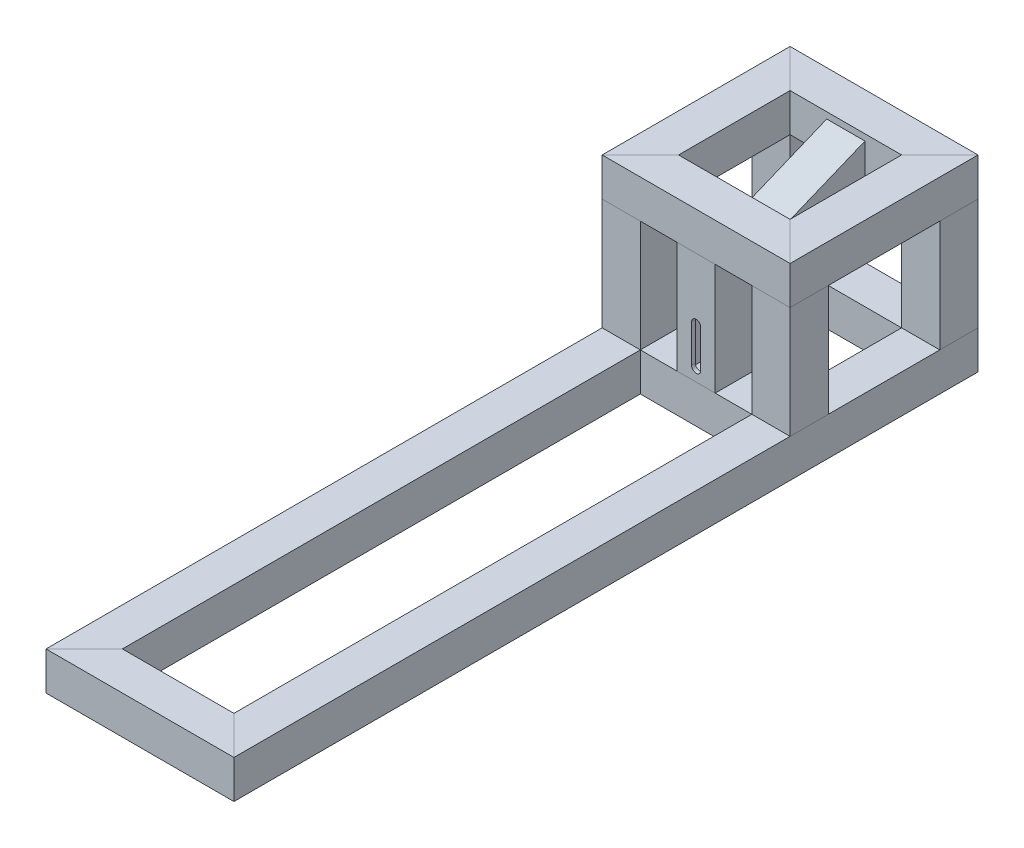
from build123d import *

# Parameters (mm, degrees)
PTR_START                             = 21.849800144
PTR_ASTM_A36_50X50X2_1_OUTLINE_W      = 50
PTR_ASTM_A36_50X50X2_1_OUTLINE_H      = 50
PTR_ASTM_A36_50X50X2_1_OUTLINE_W_2    = 40
PTR_ASTM_A36_50X50X2_1_OUTLINE_H_2    = 40
PTR_ASTM_A36_50X50X2_1_DEPTH          = 146
PTR_START_2                           = -28.150199856
PTR_ASTM_A36_50X50X2_1_2_DEPTH        = 50
PTR_ASTM_A36_50X50X2_1_3_DEPTH        = 5
PTR_START_3                           = 16.849800144
PTR_ASTM_A36_50X50X2_1_4_DEPTH        = 5
PTR_ASTM_A36_50X50X2_1_5_DEPTH        = 50
PTR_ASTM_A36_50X50X2_1_6_DEPTH        = 5
PTR_ASTM_A36_50X50X2_1_7_DEPTH        = 5
PTR_ASTM_A36_50X50X2_1_8_OUTLINE_W    = 50
PTR_ASTM_A36_50X50X2_1_8_OUTLINE_H    = 50
PTR_ASTM_A36_50X50X2_1_8_OUTLINE_W_2  = 40
PTR_ASTM_A36_50X50X2_1_8_OUTLINE_H_2  = 40
PTR_ASTM_A36_50X50X2_1_8_DEPTH        = 146
PTR_ASTM_A36_50X50X2_1_9_DEPTH        = 50
PTR_ASTM_A36_50X50X2_1_10_DEPTH       = 5
PTR_ASTM_A36_50X50X2_1_11_DEPTH       = 5
PTR_ASTM_A36_50X50X2_1_12_DEPTH       = 50
PTR_ASTM_A36_50X50X2_1_13_DEPTH       = 5
PTR_ASTM_A36_50X50X2_1_14_DEPTH       = 5
PTR_START_4                           = 167.849800144
PTR_ASTM_A36_50X50X2_1_15_DEPTH       = 50
PTR_ASTM_A36_50X50X2_1_16_DEPTH       = 5
PTR_START_5                           = 212.849800144
PTR_ASTM_A36_50X50X2_1_17_DEPTH       = 5
PTR_ASTM_A36_50X50X2_1_18_DEPTH       = 50
PTR_ASTM_A36_50X50X2_1_19_DEPTH       = 5
PTR_ASTM_A36_50X50X2_1_20_DEPTH       = 5
PTR_ASTM_A36_50X50X2_1_21_OUTLINE_W   = 50
PTR_ASTM_A36_50X50X2_1_21_OUTLINE_H   = 50
PTR_ASTM_A36_50X50X2_1_21_OUTLINE_W_2 = 40
PTR_ASTM_A36_50X50X2_1_21_OUTLINE_H_2 = 40
PTR_ASTM_A36_50X50X2_1_21_DEPTH       = 146
PTR_ASTM_A36_50X50X2_1_22_DEPTH       = 50
PTR_ASTM_A36_50X50X2_1_23_DEPTH       = 5
PTR_ASTM_A36_50X50X2_1_24_DEPTH       = 5
PTR_ASTM_A36_50X50X2_1_25_OUTLINE_W   = 50
PTR_ASTM_A36_50X50X2_1_25_OUTLINE_H   = 50
PTR_ASTM_A36_50X50X2_1_25_OUTLINE_W_2 = 40
PTR_ASTM_A36_50X50X2_1_25_OUTLINE_H_2 = 40
PTR_ASTM_A36_50X50X2_1_25_DEPTH       = 146
PTR_ASTM_A36_50X50X2_1_26_DEPTH       = 50
PTR_ASTM_A36_50X50X2_1_27_DEPTH       = 5
PTR_ASTM_A36_50X50X2_1_28_DEPTH       = 5
PTR_START_6                           = -133.458725993
PTR_ASTM_A36_50X50X2_1_29_OUTLINE_W   = 50
PTR_ASTM_A36_50X50X2_1_29_OUTLINE_H   = 50
PTR_ASTM_A36_50X50X2_1_29_OUTLINE_W_2 = 40
PTR_ASTM_A36_50X50X2_1_29_OUTLINE_H_2 = 40
PTR_ASTM_A36_50X50X2_1_29_DEPTH       = 146
PTR_ASTM_A36_50X50X2_1_30_OUTLINE_W   = 50
PTR_ASTM_A36_50X50X2_1_30_OUTLINE_H   = 50
PTR_ASTM_A36_50X50X2_1_30_OUTLINE_W_2 = 40
PTR_ASTM_A36_50X50X2_1_30_OUTLINE_H_2 = 40
PTR_ASTM_A36_50X50X2_1_30_DEPTH       = 146
PTR_START_7                           = -85.458725993
PTR_ASTM_A36_50X50X2_1_31_DEPTH       = 50
PTR_ASTM_A36_50X50X2_1_32_DEPTH       = 5
PTR_START_8                           = -40.458725993
PTR_ASTM_A36_50X50X2_1_33_DEPTH       = 5
CUT_EXTRUDE1_REACH                    = 783.729


# Read off the part's stored shape, not the designer's step: Ptr ASTM A36 50X50X2(1)
with BuildPart() as part:
    # Ptr ASTM A36 50X50X2(1) outline → Ptr ASTM A36 50X50X2(1) (new body)
    with BuildSketch(Plane(origin=(0, 0, 0), x_dir=(1, 0, 0), z_dir=(0, 1, 0)).offset(PTR_START)):
        with Locations((-158.458725993, 363.108258385)):
            Rectangle(PTR_ASTM_A36_50X50X2_1_OUTLINE_W, PTR_ASTM_A36_50X50X2_1_OUTLINE_H)
        with Locations((-158.458725993, 363.108258385)):
            Rectangle(PTR_ASTM_A36_50X50X2_1_OUTLINE_W_2, PTR_ASTM_A36_50X50X2_1_OUTLINE_H_2, mode=Mode.SUBTRACT)
    extrude(amount=PTR_ASTM_A36_50X50X2_1_DEPTH)


with BuildPart() as body_2:
    # Ptr ASTM A36 50X50X2_1 2 outline → Ptr ASTM A36 50X50X2_1 2 (new body)
    with BuildSketch(Plane(origin=(0, 0, 0), x_dir=(1, 0, 0), z_dir=(0, 1, 0)).offset(PTR_START_2)):
        Polygon((-133.458725993, 338.108258385), (12.541274007, 338.108258385), (17.541274007, 343.108258385), (-138.458725993, 343.108258385), align=None)
        Polygon((-178.458725993, 383.108258385), (57.541274007, 383.108258385), (62.541274007, 388.108258385), (-183.458725993, 388.108258385), align=None)
    extrude(amount=PTR_ASTM_A36_50X50X2_1_2_DEPTH)

    # Ptr ASTM A36 50X50X2_1 3 outline → Ptr ASTM A36 50X50X2_1 3 (add)
    with BuildSketch(Plane(origin=(0, 0, 0), x_dir=(1, 0, 0), z_dir=(0, 1, 0)).offset(PTR_START_2)):
        Polygon((-138.458725993, 343.108258385), (17.541274007, 343.108258385), (57.541274007, 383.108258385), (-178.458725993, 383.108258385), align=None)
    extrude(amount=PTR_ASTM_A36_50X50X2_1_3_DEPTH)

    # Ptr ASTM A36 50X50X2_1 4 outline → Ptr ASTM A36 50X50X2_1 4 (add)
    with BuildSketch(Plane(origin=(0, 0, 0), x_dir=(1, 0, 0), z_dir=(0, 1, 0)).offset(PTR_START_3)):
        Polygon((-138.458725993, 343.108258385), (17.541274007, 343.108258385), (57.541274007, 383.108258385), (-178.458725993, 383.108258385), align=None)
    extrude(amount=PTR_ASTM_A36_50X50X2_1_4_DEPTH)


with BuildPart() as body_3:
    # Ptr ASTM A36 50X50X2_1 5 outline → Ptr ASTM A36 50X50X2_1 5 (new body)
    with BuildSketch(Plane(origin=(0, 0, 0), x_dir=(1, 0, 0), z_dir=(0, 1, 0)).offset(PTR_START_2)):
        Polygon((-133.458725993, -535.891741615), (-133.458725993, 338.108258385), (-138.458725993, 343.108258385), (-138.458725993, -540.891741615), align=None)
        Polygon((-178.458725993, -580.891741615), (-178.458725993, 383.108258385), (-183.458725993, 388.108258385), (-183.458725993, -585.891741615), align=None)
    extrude(amount=PTR_ASTM_A36_50X50X2_1_5_DEPTH)

    # Ptr ASTM A36 50X50X2_1 6 outline → Ptr ASTM A36 50X50X2_1 6 (add)
    with BuildSketch(Plane(origin=(0, 0, 0), x_dir=(1, 0, 0), z_dir=(0, 1, 0)).offset(PTR_START_2)):
        Polygon((-138.458725993, -540.891741615), (-138.458725993, 343.108258385), (-178.458725993, 383.108258385), (-178.458725993, -580.891741615), align=None)
    extrude(amount=PTR_ASTM_A36_50X50X2_1_6_DEPTH)

    # Ptr ASTM A36 50X50X2_1 7 outline → Ptr ASTM A36 50X50X2_1 7 (add)
    with BuildSketch(Plane(origin=(0, 0, 0), x_dir=(1, 0, 0), z_dir=(0, 1, 0)).offset(PTR_START_3)):
        Polygon((-138.458725993, -540.891741615), (-138.458725993, 343.108258385), (-178.458725993, 383.108258385), (-178.458725993, -580.891741615), align=None)
    extrude(amount=PTR_ASTM_A36_50X50X2_1_7_DEPTH)


with BuildPart() as body_4:
    # Ptr ASTM A36 50X50X2_1 8 outline → Ptr ASTM A36 50X50X2_1 8 (new body)
    with BuildSketch(Plane(origin=(0, 0, 0), x_dir=(1, 0, 0), z_dir=(0, 1, 0)).offset(PTR_START)):
        with Locations((37.541274007, 363.108258385)):
            Rectangle(PTR_ASTM_A36_50X50X2_1_8_OUTLINE_W, PTR_ASTM_A36_50X50X2_1_8_OUTLINE_H)
        with Locations((37.541274007, 363.108258385)):
            Rectangle(PTR_ASTM_A36_50X50X2_1_8_OUTLINE_W_2, PTR_ASTM_A36_50X50X2_1_8_OUTLINE_H_2, mode=Mode.SUBTRACT)
    extrude(amount=PTR_ASTM_A36_50X50X2_1_8_DEPTH)


with BuildPart() as body_5:
    # Ptr ASTM A36 50X50X2_1 9 outline → Ptr ASTM A36 50X50X2_1 9 (new body)
    with BuildSketch(Plane(origin=(0, 0, 0), x_dir=(1, 0, 0), z_dir=(0, 1, 0)).offset(PTR_START_2)):
        Polygon((12.541274007, 338.108258385), (12.541274007, -535.891741615), (17.541274007, -540.891741615), (17.541274007, 343.108258385), align=None)
        Polygon((57.541274007, 383.108258385), (57.541274007, -580.891741615), (62.541274007, -585.891741615), (62.541274007, 388.108258385), align=None)
    extrude(amount=PTR_ASTM_A36_50X50X2_1_9_DEPTH)

    # Ptr ASTM A36 50X50X2_1 10 outline → Ptr ASTM A36 50X50X2_1 10 (add)
    with BuildSketch(Plane(origin=(0, 0, 0), x_dir=(1, 0, 0), z_dir=(0, 1, 0)).offset(PTR_START_2)):
        Polygon((17.541274007, 343.108258385), (17.541274007, -540.891741615), (57.541274007, -580.891741615), (57.541274007, 383.108258385), align=None)
    extrude(amount=PTR_ASTM_A36_50X50X2_1_10_DEPTH)

    # Ptr ASTM A36 50X50X2_1 11 outline → Ptr ASTM A36 50X50X2_1 11 (add)
    with BuildSketch(Plane(origin=(0, 0, 0), x_dir=(1, 0, 0), z_dir=(0, 1, 0)).offset(PTR_START_3)):
        Polygon((17.541274007, 343.108258385), (17.541274007, -540.891741615), (57.541274007, -580.891741615), (57.541274007, 383.108258385), align=None)
    extrude(amount=PTR_ASTM_A36_50X50X2_1_11_DEPTH)


with BuildPart() as body_6:
    # Ptr ASTM A36 50X50X2_1 12 outline → Ptr ASTM A36 50X50X2_1 12 (new body)
    with BuildSketch(Plane(origin=(0, 0, 0), x_dir=(1, 0, 0), z_dir=(0, 1, 0)).offset(PTR_START_2)):
        Polygon((12.541274007, -535.891741615), (-133.458725993, -535.891741615), (-138.458725993, -540.891741615), (17.541274007, -540.891741615), align=None)
        Polygon((57.541274007, -580.891741615), (-178.458725993, -580.891741615), (-183.458725993, -585.891741615), (62.541274007, -585.891741615), align=None)
    extrude(amount=PTR_ASTM_A36_50X50X2_1_12_DEPTH)

    # Ptr ASTM A36 50X50X2_1 13 outline → Ptr ASTM A36 50X50X2_1 13 (add)
    with BuildSketch(Plane(origin=(0, 0, 0), x_dir=(1, 0, 0), z_dir=(0, 1, 0)).offset(PTR_START_2)):
        Polygon((17.541274007, -540.891741615), (-138.458725993, -540.891741615), (-178.458725993, -580.891741615), (57.541274007, -580.891741615), align=None)
    extrude(amount=PTR_ASTM_A36_50X50X2_1_13_DEPTH)

    # Ptr ASTM A36 50X50X2_1 14 outline → Ptr ASTM A36 50X50X2_1 14 (add)
    with BuildSketch(Plane(origin=(0, 0, 0), x_dir=(1, 0, 0), z_dir=(0, 1, 0)).offset(PTR_START_3)):
        Polygon((17.541274007, -540.891741615), (-138.458725993, -540.891741615), (-178.458725993, -580.891741615), (57.541274007, -580.891741615), align=None)
    extrude(amount=PTR_ASTM_A36_50X50X2_1_14_DEPTH)


with BuildPart() as body_7:
    # Ptr ASTM A36 50X50X2_1 15 outline → Ptr ASTM A36 50X50X2_1 15 (new body)
    with BuildSketch(Plane(origin=(0, 0, 0), x_dir=(1, 0, 0), z_dir=(0, 1, 0)).offset(PTR_START_4)):
        Polygon((-183.458725993, 388.108258385), (-183.458725993, 142.108258385), (-178.458725993, 147.108258385), (-178.458725993, 383.108258385), align=None)
        Polygon((-138.458725993, 343.108258385), (-138.458725993, 187.108258385), (-133.458725993, 192.108258385), (-133.458725993, 338.108258385), align=None)
    extrude(amount=PTR_ASTM_A36_50X50X2_1_15_DEPTH)

    # Ptr ASTM A36 50X50X2_1 16 outline → Ptr ASTM A36 50X50X2_1 16 (add)
    with BuildSketch(Plane(origin=(0, 0, 0), x_dir=(1, 0, 0), z_dir=(0, 1, 0)).offset(PTR_START_4)):
        Polygon((-178.458725993, 383.108258385), (-178.458725993, 147.108258385), (-138.458725993, 187.108258385), (-138.458725993, 343.108258385), align=None)
    extrude(amount=PTR_ASTM_A36_50X50X2_1_16_DEPTH)

    # Ptr ASTM A36 50X50X2_1 17 outline → Ptr ASTM A36 50X50X2_1 17 (add)
    with BuildSketch(Plane(origin=(0, 0, 0), x_dir=(1, 0, 0), z_dir=(0, 1, 0)).offset(PTR_START_5)):
        Polygon((-178.458725993, 383.108258385), (-178.458725993, 147.108258385), (-138.458725993, 187.108258385), (-138.458725993, 343.108258385), align=None)
    extrude(amount=PTR_ASTM_A36_50X50X2_1_17_DEPTH)


with BuildPart() as body_8:
    # Ptr ASTM A36 50X50X2_1 18 outline → Ptr ASTM A36 50X50X2_1 18 (new body)
    with BuildSketch(Plane(origin=(0, 0, 0), x_dir=(1, 0, 0), z_dir=(0, 1, 0)).offset(PTR_START_4)):
        Polygon((62.541274007, 388.108258385), (-183.458725993, 388.108258385), (-178.458725993, 383.108258385), (57.541274007, 383.108258385), align=None)
        Polygon((17.541274007, 343.108258385), (-138.458725993, 343.108258385), (-133.458725993, 338.108258385), (12.541274007, 338.108258385), align=None)
    extrude(amount=PTR_ASTM_A36_50X50X2_1_18_DEPTH)

    # Ptr ASTM A36 50X50X2_1 19 outline → Ptr ASTM A36 50X50X2_1 19 (add)
    with BuildSketch(Plane(origin=(0, 0, 0), x_dir=(1, 0, 0), z_dir=(0, 1, 0)).offset(PTR_START_4)):
        Polygon((57.541274007, 383.108258385), (-178.458725993, 383.108258385), (-138.458725993, 343.108258385), (17.541274007, 343.108258385), align=None)
    extrude(amount=PTR_ASTM_A36_50X50X2_1_19_DEPTH)

    # Ptr ASTM A36 50X50X2_1 20 outline → Ptr ASTM A36 50X50X2_1 20 (add)
    with BuildSketch(Plane(origin=(0, 0, 0), x_dir=(1, 0, 0), z_dir=(0, 1, 0)).offset(PTR_START_5)):
        Polygon((57.541274007, 383.108258385), (-178.458725993, 383.108258385), (-138.458725993, 343.108258385), (17.541274007, 343.108258385), align=None)
    extrude(amount=PTR_ASTM_A36_50X50X2_1_20_DEPTH)


with BuildPart() as body_9:
    # Ptr ASTM A36 50X50X2_1 21 outline → Ptr ASTM A36 50X50X2_1 21 (new body)
    with BuildSketch(Plane(origin=(0, 0, 0), x_dir=(1, 0, 0), z_dir=(0, 1, 0)).offset(PTR_START)):
        with Locations((-158.458725993, 167.108258385)):
            Rectangle(PTR_ASTM_A36_50X50X2_1_21_OUTLINE_W, PTR_ASTM_A36_50X50X2_1_21_OUTLINE_H)
        with Locations((-158.458725993, 167.108258385)):
            Rectangle(PTR_ASTM_A36_50X50X2_1_21_OUTLINE_W_2, PTR_ASTM_A36_50X50X2_1_21_OUTLINE_H_2, mode=Mode.SUBTRACT)
    extrude(amount=PTR_ASTM_A36_50X50X2_1_21_DEPTH)


with BuildPart() as body_10:
    # Ptr ASTM A36 50X50X2_1 22 outline → Ptr ASTM A36 50X50X2_1 22 (new body)
    with BuildSketch(Plane(origin=(0, 0, 0), x_dir=(1, 0, 0), z_dir=(0, 1, 0)).offset(PTR_START_4)):
        Polygon((-183.458725993, 142.108258385), (62.541274007, 142.108258385), (57.541274007, 147.108258385), (-178.458725993, 147.108258385), align=None)
        Polygon((-138.458725993, 187.108258385), (17.541274007, 187.108258385), (12.541274007, 192.108258385), (-133.458725993, 192.108258385), align=None)
    extrude(amount=PTR_ASTM_A36_50X50X2_1_22_DEPTH)

    # Ptr ASTM A36 50X50X2_1 23 outline → Ptr ASTM A36 50X50X2_1 23 (add)
    with BuildSketch(Plane(origin=(0, 0, 0), x_dir=(1, 0, 0), z_dir=(0, 1, 0)).offset(PTR_START_4)):
        Polygon((-178.458725993, 147.108258385), (57.541274007, 147.108258385), (17.541274007, 187.108258385), (-138.458725993, 187.108258385), align=None)
    extrude(amount=PTR_ASTM_A36_50X50X2_1_23_DEPTH)

    # Ptr ASTM A36 50X50X2_1 24 outline → Ptr ASTM A36 50X50X2_1 24 (add)
    with BuildSketch(Plane(origin=(0, 0, 0), x_dir=(1, 0, 0), z_dir=(0, 1, 0)).offset(PTR_START_5)):
        Polygon((-178.458725993, 147.108258385), (57.541274007, 147.108258385), (17.541274007, 187.108258385), (-138.458725993, 187.108258385), align=None)
    extrude(amount=PTR_ASTM_A36_50X50X2_1_24_DEPTH)


with BuildPart() as body_11:
    # Ptr ASTM A36 50X50X2_1 25 outline → Ptr ASTM A36 50X50X2_1 25 (new body)
    with BuildSketch(Plane(origin=(0, 0, 0), x_dir=(1, 0, 0), z_dir=(0, 1, 0)).offset(PTR_START)):
        with Locations((37.541274007, 167.108258385)):
            Rectangle(PTR_ASTM_A36_50X50X2_1_25_OUTLINE_W, PTR_ASTM_A36_50X50X2_1_25_OUTLINE_H)
        with Locations((37.541274007, 167.108258385)):
            Rectangle(PTR_ASTM_A36_50X50X2_1_25_OUTLINE_W_2, PTR_ASTM_A36_50X50X2_1_25_OUTLINE_H_2, mode=Mode.SUBTRACT)
    extrude(amount=PTR_ASTM_A36_50X50X2_1_25_DEPTH)


with BuildPart() as body_12:
    # Ptr ASTM A36 50X50X2_1 26 outline → Ptr ASTM A36 50X50X2_1 26 (new body)
    with BuildSketch(Plane(origin=(0, 0, 0), x_dir=(1, 0, 0), z_dir=(0, 1, 0)).offset(PTR_START_4)):
        Polygon((62.541274007, 142.108258385), (62.541274007, 388.108258385), (57.541274007, 383.108258385), (57.541274007, 147.108258385), align=None)
        Polygon((17.541274007, 187.108258385), (17.541274007, 343.108258385), (12.541274007, 338.108258385), (12.541274007, 192.108258385), align=None)
    extrude(amount=PTR_ASTM_A36_50X50X2_1_26_DEPTH)

    # Ptr ASTM A36 50X50X2_1 27 outline → Ptr ASTM A36 50X50X2_1 27 (add)
    with BuildSketch(Plane(origin=(0, 0, 0), x_dir=(1, 0, 0), z_dir=(0, 1, 0)).offset(PTR_START_4)):
        Polygon((57.541274007, 147.108258385), (57.541274007, 383.108258385), (17.541274007, 343.108258385), (17.541274007, 187.108258385), align=None)
    extrude(amount=PTR_ASTM_A36_50X50X2_1_27_DEPTH)

    # Ptr ASTM A36 50X50X2_1 28 outline → Ptr ASTM A36 50X50X2_1 28 (add)
    with BuildSketch(Plane(origin=(0, 0, 0), x_dir=(1, 0, 0), z_dir=(0, 1, 0)).offset(PTR_START_5)):
        Polygon((57.541274007, 147.108258385), (57.541274007, 383.108258385), (17.541274007, 343.108258385), (17.541274007, 187.108258385), align=None)
    extrude(amount=PTR_ASTM_A36_50X50X2_1_28_DEPTH)


with BuildPart() as body_13:
    # Ptr ASTM A36 50X50X2_1 29 outline → Ptr ASTM A36 50X50X2_1 29 (new body)
    with BuildSketch(Plane.YZ.offset(PTR_START_6)):
        with Locations((-3.150199856, -167.108258385)):
            Rectangle(PTR_ASTM_A36_50X50X2_1_29_OUTLINE_W, PTR_ASTM_A36_50X50X2_1_29_OUTLINE_H)
        with Locations((-3.150199856, -167.108258385)):
            Rectangle(PTR_ASTM_A36_50X50X2_1_29_OUTLINE_W_2, PTR_ASTM_A36_50X50X2_1_29_OUTLINE_H_2, mode=Mode.SUBTRACT)
    extrude(amount=PTR_ASTM_A36_50X50X2_1_29_DEPTH)


with BuildPart() as body_14:
    # Ptr ASTM A36 50X50X2_1 30 outline → Ptr ASTM A36 50X50X2_1 30 (new body)
    with BuildSketch(Plane(origin=(0, 0, 0), x_dir=(1, 0, 0), z_dir=(0, 1, 0)).offset(PTR_START)):
        with Locations((-60.458725993, 167.108258385)):
            Rectangle(PTR_ASTM_A36_50X50X2_1_30_OUTLINE_W, PTR_ASTM_A36_50X50X2_1_30_OUTLINE_H)
        with Locations((-60.458725993, 167.108258385)):
            Rectangle(PTR_ASTM_A36_50X50X2_1_30_OUTLINE_W_2, PTR_ASTM_A36_50X50X2_1_30_OUTLINE_H_2, mode=Mode.SUBTRACT)
    extrude(amount=PTR_ASTM_A36_50X50X2_1_30_DEPTH)

    # Cut-Extrude1: up to this face of the body (flat: up to its plane)
    cut_extrude1_end = Plane(body_14.part.faces().sort_by_distance((-60.458725993, 94.849800144, -192.108258385))[0])
    # Sketch115 → Cut-Extrude1 (cut, up to the picked face)
    with BuildSketch(Plane.XY.offset(-142.108258385), mode=Mode.PRIVATE) as cut_extrude1_sk1:
        with BuildLine():
            Line((-66.458725993, 37.849800144), (-66.458725993, 87.099800144))
            ThreePointArc((-66.458725993, 87.099800144), (-60.458725993, 93.099800144), (-54.458725993, 87.099800144))
            Line((-54.458725993, 87.099800144), (-54.458725993, 37.849800144))
            ThreePointArc((-54.458725993, 37.849800144), (-60.458725993, 31.849800144), (-66.458725993, 37.849800144))
        make_face()
    cut_extrude1_tool1 = split(extrude(cut_extrude1_sk1.sketch, amount=-CUT_EXTRUDE1_REACH, mode=Mode.PRIVATE), bisect_by=cut_extrude1_end, keep=Keep.BOTH, mode=Mode.PRIVATE)
    add(cut_extrude1_tool1.solids().sort_by(Axis((-60.458726, 62.4748, -142.108258), (0, 0, -1)))[0], mode=Mode.SUBTRACT)


with BuildPart() as body_15:
    # Ptr ASTM A36 50X50X2_1 31 outline → Ptr ASTM A36 50X50X2_1 31 (new body)
    with BuildSketch(Plane.YZ.offset(PTR_START_7)):
        Polygon((95.471486915, -192.108258385), (167.849800144, -368.049587826), (167.849800144, -354.907036933), (100.878037316, -192.108258385), align=None)
        Polygon((149.536990924, -192.108258385), (144.130440523, -192.108258385), (204.191562972, -338.108258385), (209.598113373, -338.108258385), align=None)
    extrude(amount=PTR_ASTM_A36_50X50X2_1_31_DEPTH)

    # Ptr ASTM A36 50X50X2_1 32 outline → Ptr ASTM A36 50X50X2_1 32 (add)
    with BuildSketch(Plane.YZ.offset(PTR_START_7)):
        Polygon((100.878037316, -192.108258385), (167.849800144, -354.907036933), (167.849800144, -338.108258385), (204.191562972, -338.108258385), (144.130440523, -192.108258385), align=None)
    extrude(amount=PTR_ASTM_A36_50X50X2_1_32_DEPTH)

    # Ptr ASTM A36 50X50X2_1 33 outline → Ptr ASTM A36 50X50X2_1 33 (add)
    with BuildSketch(Plane.YZ.offset(PTR_START_8)):
        Polygon((100.878037316, -192.108258385), (167.849800144, -354.907036933), (167.849800144, -338.108258385), (204.191562972, -338.108258385), (144.130440523, -192.108258385), align=None)
    extrude(amount=PTR_ASTM_A36_50X50X2_1_33_DEPTH)


solid = Compound([part.part, body_2.part, body_3.part, body_4.part, body_5.part, body_6.part, body_7.part, body_8.part, body_9.part, body_10.part, body_11.part, body_12.part, body_13.part, body_14.part, body_15.part])
